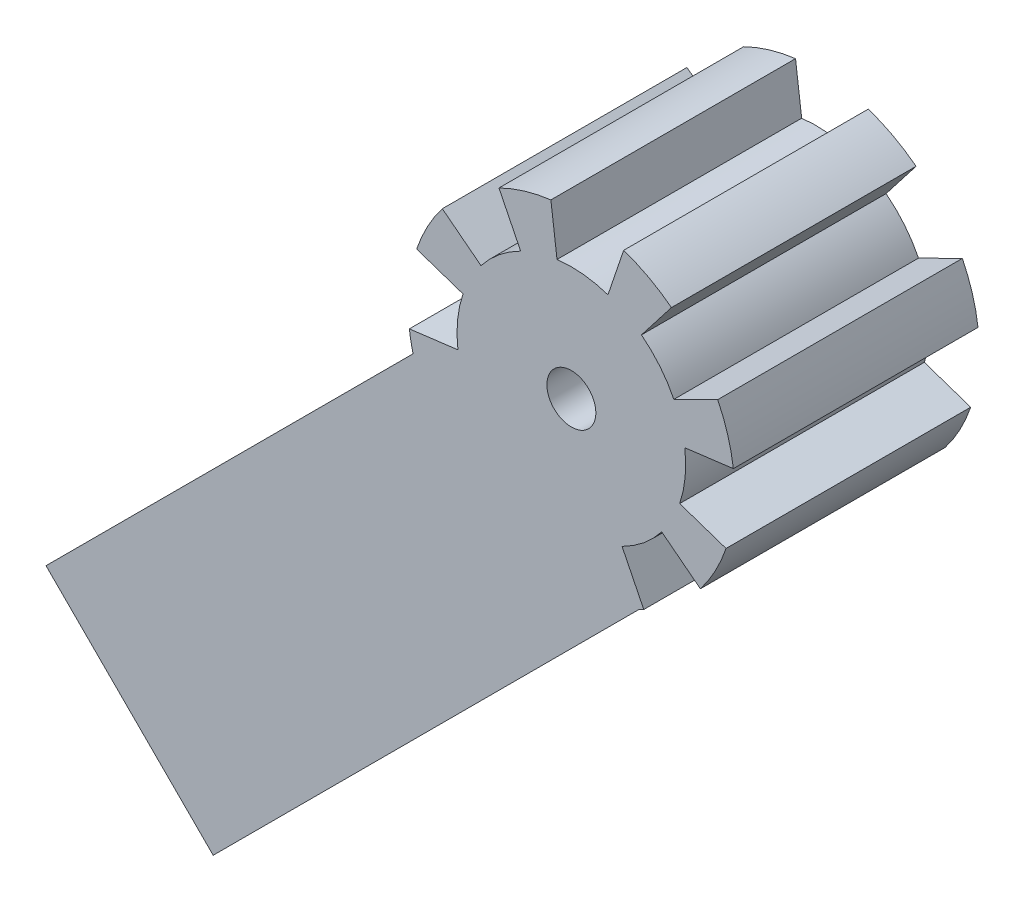
from build123d import *

# Parameters (mm, degrees)
SKETCH1_R           = 13.348229866
SKETCH1_R_2         = 2
BOSS_EXTRUDE1_DEPTH = 20
CUT_EXTRUDE4_DEPTH  = 91.243420293
CIRPATTERN7_COUNT   = 4
CIRPATTERN7_ANGLE   = 135
CIRPATTERN9_DEPTH   = 20


# Read off the part's stored shape, not the designer's step: CirPattern9
with BuildPart() as part:
    # Sketch1 → Boss-Extrude1 (new body)
    # profile 1 of 2: a face of its own
    with BuildSketch(Plane.XY):
        with Locations((-60.602362619, 34.350667158)):
            Circle(SKETCH1_R)
        with Locations((-60.602362619, 34.350667158)):
            Circle(SKETCH1_R_2, mode=Mode.SUBTRACT)
    # profile 2 of 2: a face of its own
    with BuildSketch(Plane.XY):
        with BuildLine():
            Line((-66.137497339, 22.204164608), (-31.323181793, -12.610150938))
            Line((-31.323181793, -12.610150938), (-17.655141573, 1.057889282))
            Line((-17.655141573, 1.057889282), (-47.664311726, 31.067059435))
            ThreePointArc((-47.664311726, 31.067059435), (-54.828410927, 22.315854221), (-66.137497339, 22.204164608))
        make_face()
    extrude(amount=BOSS_EXTRUDE1_DEPTH)

    # Sketch2 → Cut-Extrude4 (cut, symmetric)
    with BuildSketch(Plane.XY):
        with BuildLine():
            Line((-169.23850632, 174.404401772), (-68.783555417, 44.897862281))
            Line((-68.783555417, 44.897862281), (-66.331936624, 41.737234923))
            ThreePointArc((-66.331936624, 41.737234923), (-67.840347325, 40.266829683), (-68.981232991, 38.496017917))
            Line((-68.981232991, 38.496017917), (-72.566455217, 40.269765811))
            Line((-72.566455217, 40.269765811), (-219.470747071, 112.948992325))
            Line((-219.470747071, 112.948992325), (-473.273699138, 320.401698382))
            Line((-473.273699138, 320.401698382), (-423.041458386, 381.857107829))
            Line((-423.041458386, 381.857107829), (-169.23850632, 174.404401772))
        make_face()
    cut_extrude4 = extrude(amount=CUT_EXTRUDE4_DEPTH, both=True, mode=Mode.SUBTRACT)

    # CirPattern7: Cut-Extrude4 ×4 about axis
    cirpattern7_axis = Axis((-60.602362619, 34.350667158, 20), (0, 0, -1))
    for i in range(1, CIRPATTERN7_COUNT):
        add(cut_extrude4.rotate(cirpattern7_axis, i * CIRPATTERN7_ANGLE / (CIRPATTERN7_COUNT - 1)), mode=Mode.SUBTRACT)

    # CirPattern9 outline → CirPattern9 (cut)
    with BuildSketch(Plane.XY):
        with BuildLine():
            Line((-73.247688421, 30.076210947), (-69.45832431, 31.357116731))
            ThreePointArc((-69.45832431, 31.357116731), (-69.903749327, 33.41599773), (-69.876875408, 35.522338682))
            Line((-69.876875408, 35.522338682), (-73.845332718, 36.023683446))
            ThreePointArc((-73.845332718, 36.023683446), (-73.883705678, 33.016063436), (-73.247688421, 30.076210947))
        make_face()
        with BuildLine():
            Line((-67.988930384, 28.621093153), (-71.149557741, 26.16947436))
            ThreePointArc((-71.149557741, 26.16947436), (-69.049983017, 24.015632075), (-66.521461271, 22.386574559))
            Line((-66.521461271, 22.386574559), (-64.747713378, 25.971796785))
            ThreePointArc((-64.747713378, 25.971796785), (-66.518525144, 27.112682451), (-67.988930384, 28.621093153))
        make_face()
    extrude(amount=CIRPATTERN9_DEPTH, mode=Mode.SUBTRACT)


with BuildPart() as body_2:
    # Mirror2: mirrored copy
    add(part.part.mirror(Plane(origin=(0, 0, 0), x_dir=(0, 0, 1), z_dir=(1, 0, 0))))


solid = body_2.part
